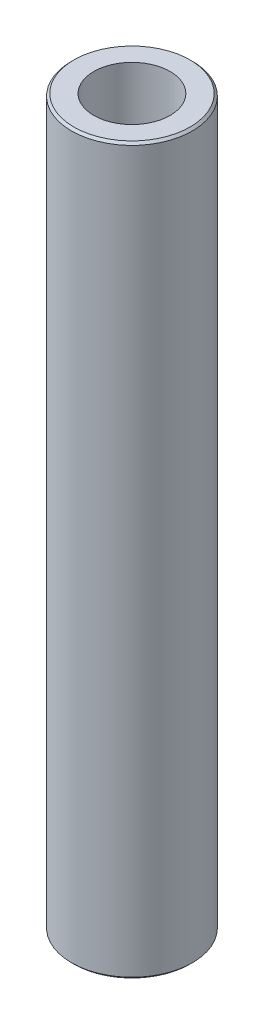
from build123d import *

# Parameters (mm, degrees)
SKETCH1_R           = 50
BOSS_EXTRUDE1_DEPTH = 600
SKETCH2_R           = 31.560179057
CUT_EXTRUDE1_DEPTH  = 605.15229868
CHAMFER1_SIZE       = 1.886492285


with BuildPart() as part:
    # Sketch1 → Boss-Extrude1 (new body)
    with BuildSketch(Plane(origin=(0, 0, 0), x_dir=(1, 0, 0), z_dir=(0, 1, 0))):
        Circle(SKETCH1_R)
    extrude(amount=BOSS_EXTRUDE1_DEPTH)

    # Sketch2 → Cut-Extrude1 (cut, through all)
    with BuildSketch(Plane(origin=(0, 0, 0), x_dir=(1, 0, 0), z_dir=(0, 1, 0))):
        Circle(SKETCH2_R)
    extrude(amount=CUT_EXTRUDE1_DEPTH, mode=Mode.SUBTRACT)

    # Chamfer1
    chamfer1_edges = [part.edges().sort_by_distance(p)[0] for p in [
        (-50, 600, 0),
        (-50, 0, 0),
    ]]
    chamfer(chamfer1_edges, length=CHAMFER1_SIZE)


solid = part.part
